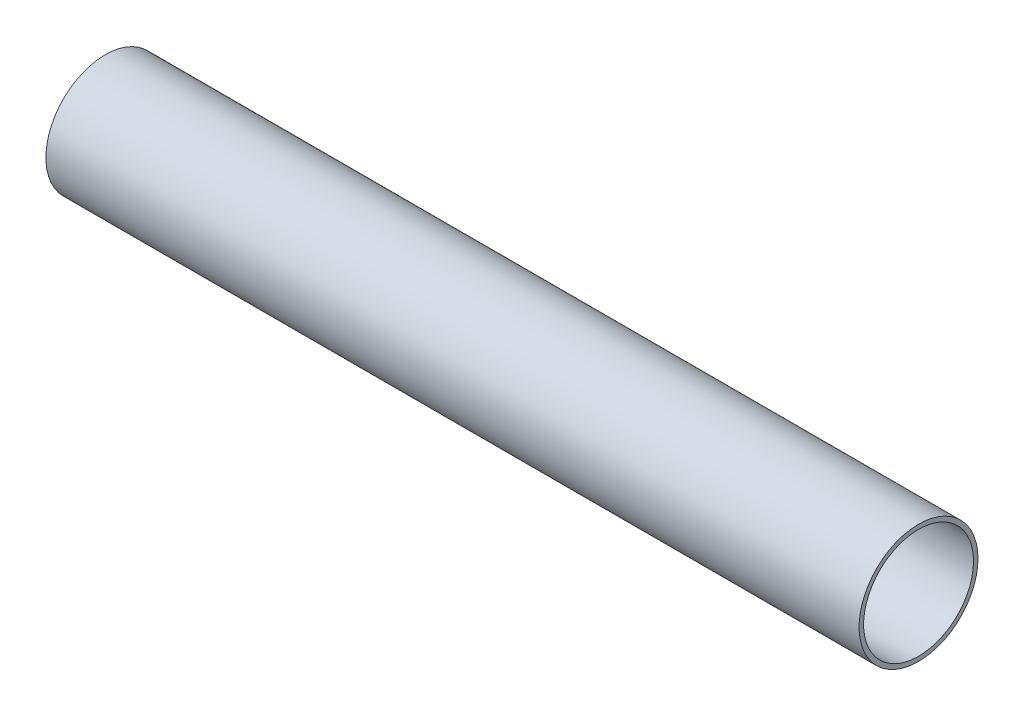
from build123d import *

# Parameters (mm, degrees)
SKETCH1_R           = 17.171437949
SKETCH1_R_2         = 15.875
BOSS_EXTRUDE1_DEPTH = 117.459125


with BuildPart() as part:
    # Sketch1 → Boss-Extrude1 (new, symmetric)
    with BuildSketch(Plane(origin=(0, 0, 0), x_dir=(0, 0, -1), z_dir=(1, 0, 0))):
        Circle(SKETCH1_R)
        Circle(SKETCH1_R_2, mode=Mode.SUBTRACT)
    extrude(amount=BOSS_EXTRUDE1_DEPTH, both=True)


solid = part.part
